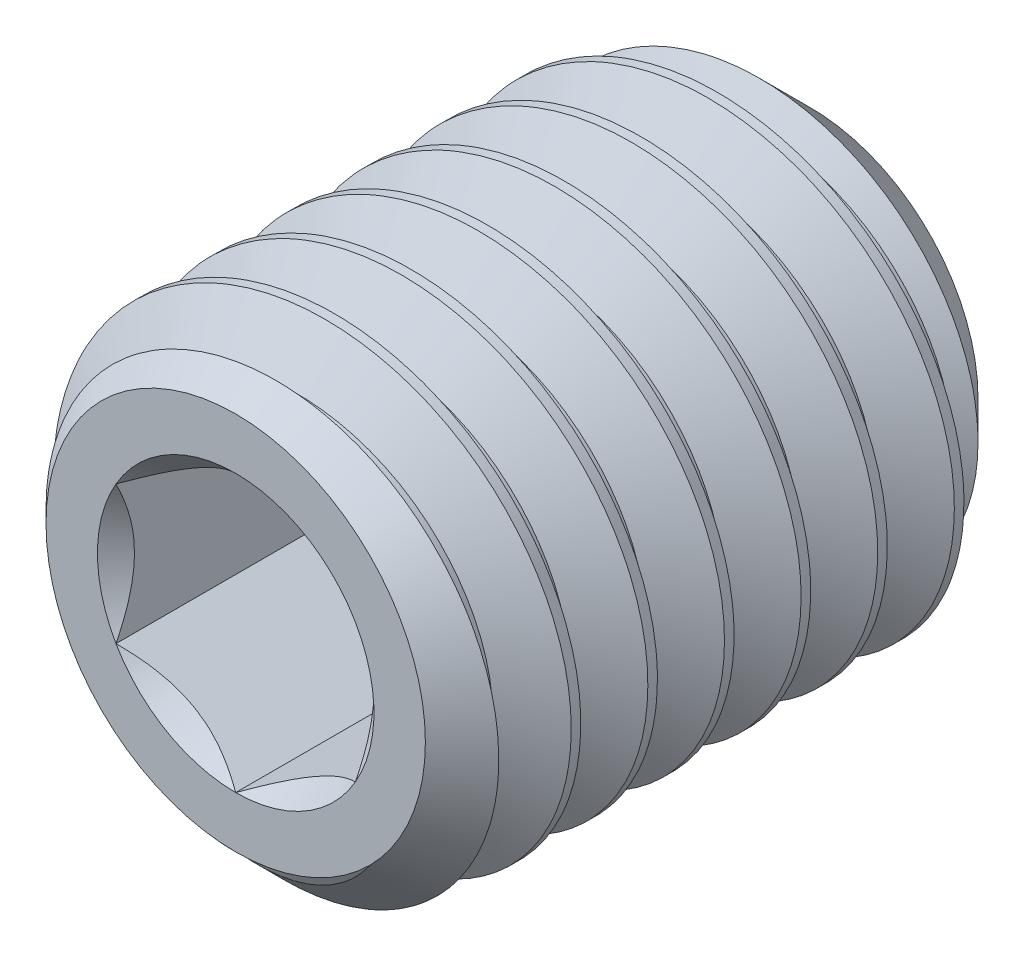
from build123d import *

# Parameters (mm, degrees)
CUT_EXTRUDE1_DEPTH = 3
CUT_SWEEP1_PITCH   = 0.8


with BuildPart() as part:
    # Sketch2 → Revolve1 (revolve)
    with BuildSketch(Plane(origin=(0, 0, 0), x_dir=(0, 0, -1), z_dir=(1, 0, 0)), mode=Mode.PRIVATE) as revolve1_sk:
        Polygon((-3, 0), (3, 0), (3, 1.75), (2.25, 2.5), (-2.480384758, 2.5), (-3, 1.980384758), align=None)
    revolve(revolve1_sk.sketch.rotate(Axis((0, 0, 3), (0, 0, -1)), 90), axis=Axis((0, 0, 3), (0, 0, -1)))

    # Sketch3 → Cut-Extrude1 (cut)
    with BuildSketch(Plane.XY.offset(3)):
        Polygon((0, 1.443375673), (-1.25, 0.721687836), (-1.25, -0.721687836), (0, -1.443375673), (1.25, -0.721687836), (1.25, 0.721687836), align=None)
    extrude(amount=-CUT_EXTRUDE1_DEPTH, mode=Mode.SUBTRACT)

    # Cut-Extrude2 cone 1 section (through the dimple's axis) → Cut-Extrude2 (revolve, cut)
    with BuildSketch(Plane(origin=(0, 0, 0), x_dir=(0, -1, 0), z_dir=(1, 0, 0))):
        Polygon((0, 0), (1.25, 0), (0, 0.721687836), align=None)
    revolve(axis=Axis((0, 0, 0), (0, 0, -1)), mode=Mode.SUBTRACT)

    # Cut-Extrude3 cone 1 section (through the dimple's axis) → Cut-Extrude3 (revolve, cut)
    with BuildSketch(Plane(origin=(0, 0, 3), x_dir=(0, -1, 0), z_dir=(1, 0, 0))):
        Polygon((0, 0), (1.443375673, 0), (0, 1.443375673), align=None)
    revolve(axis=Axis((0, 0, 3), (0, 0, -1)), mode=Mode.SUBTRACT)

    # Cut-Sweep1: the profile of Sketch7 screwed along a right-hand helix of 8.5 turns, 8 arcs to a turn; built about Z, then put on its axis
    cut_sweep1_z = Axis((0, 0, 0), (0, 0, 1))
    cut_sweep1_corners = [(2.54330127, 0, -0.725), (2.54330127, 0, 0.025), (1.980384758, 0, -0.3), (1.980384758, 0, -0.4)]
    with BuildLine(mode=Mode.PRIVATE) as cut_sweep1_profile:
        Line(cut_sweep1_corners[0], cut_sweep1_corners[1])
        Line(cut_sweep1_corners[1], cut_sweep1_corners[2])
        Line(cut_sweep1_corners[2], cut_sweep1_corners[3])
        Line(cut_sweep1_corners[3], cut_sweep1_corners[0])
    cut_sweep1_cap = Face(cut_sweep1_profile.wire())
    cut_sweep1_turn_angles = [0, 22.5, 45, 67.5, 90, 112.5, 135, 157.5, 180, 202.5, 225, 247.5, 270, 292.5, 315, 337.5, 360]
    cut_sweep1_turn_weights = [1, 0.9238795325112867, 1, 0.9238795325112867, 1, 0.9238795325112867, 1, 0.9238795325112867, 1, 0.9238795325112867, 1, 0.9238795325112867, 1, 0.9238795325112867, 1, 0.9238795325112867, 1]
    cut_sweep1_turn_rails = [Edge.make_bspline([Vector(p[0], p[1], 0).rotate(cut_sweep1_z, cut_sweep1_turn_angles[k]) / cut_sweep1_turn_weights[k] + Vector(0, 0, p[2] + CUT_SWEEP1_PITCH * cut_sweep1_turn_angles[k] / 360) for k in range(17)], [0, 0, 0, 1, 1, 2, 2, 3, 3, 4, 4, 5, 5, 6, 6, 7, 7, 8, 8, 8], 2, cut_sweep1_turn_weights) for p in cut_sweep1_corners]
    cut_sweep1_turn_sides = [Face.make_surface_from_curves(cut_sweep1_turn_rails[p[0]], cut_sweep1_turn_rails[p[1]]) for p in [(0, 1), (1, 2), (2, 3), (3, 0)]]
    cut_sweep1_last_angles = [2880, 2902.5, 2925, 2947.5, 2970, 2992.5, 3015, 3037.5, 3060]
    cut_sweep1_last_weights = [1, 0.9238795325112867, 1, 0.9238795325112867, 1, 0.9238795325112867, 1, 0.9238795325112792, 1]
    cut_sweep1_last_rails = [Edge.make_bspline([Vector(p[0], p[1], 0).rotate(cut_sweep1_z, cut_sweep1_last_angles[k]) / cut_sweep1_last_weights[k] + Vector(0, 0, p[2] + CUT_SWEEP1_PITCH * cut_sweep1_last_angles[k] / 360) for k in range(9)], [0, 0, 0, 1, 1, 2, 2, 3, 3, 4, 4, 4], 2, cut_sweep1_last_weights) for p in cut_sweep1_corners]
    cut_sweep1_last_sides = [Face.make_surface_from_curves(cut_sweep1_last_rails[p[0]], cut_sweep1_last_rails[p[1]]) for p in [(0, 1), (1, 2), (2, 3), (3, 0)]]
    cut_sweep1 = Plane(origin=(0, 0, 3), x_dir=(0, 1, 0), z_dir=(0, 0, -1)) * Solid(Shell([*[p.moved(Location((0, 0, CUT_SWEEP1_PITCH * i))) for i in range(8) for p in cut_sweep1_turn_sides], *cut_sweep1_last_sides, cut_sweep1_cap, cut_sweep1_cap.rotate(cut_sweep1_z, 3060).moved(Location((0, 0, CUT_SWEEP1_PITCH * 3060 / 360)))]))
    add(cut_sweep1, mode=Mode.SUBTRACT)


solid = part.part
